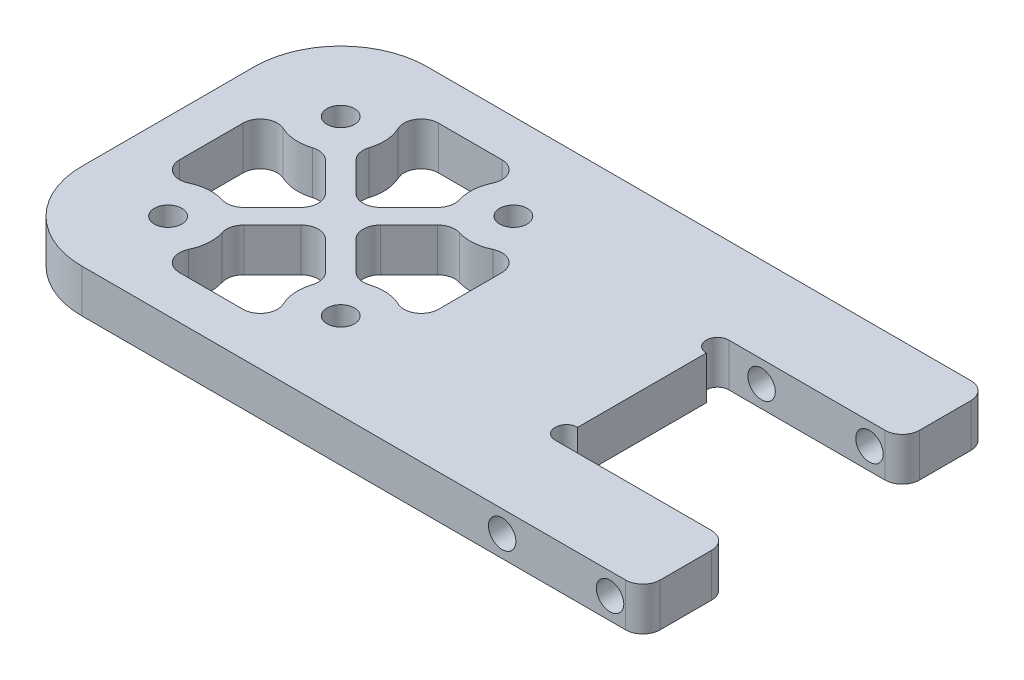
from build123d import *

# Parameters (mm, degrees)
BOSS_EXTRUDE1_DEPTH    = 6.35
F_10_32_TAPPED_HOLE2_D = 4.0386
SKETCH5_W              = 25.527
SKETCH5_H              = 25.526999999999994
CUT_EXTRUDE1_DEPTH     = 66.76160068763534
CUT_EXTRUDE2_DEPTH     = 66.76160068763534
FILLET1_R              = 2.54
FILLET2_R              = 12.7
F_10_32_TAPPED_HOLE1_D = 4.0386
CUT_EXTRUDE3_DEPTH     = 66.76160068763534
FILLET3_R              = 2.54


with BuildPart() as part:
    # Sketch1 → Boss-Extrude1 (new body)
    with BuildSketch(Plane(origin=(0, 0, 0), x_dir=(1, 0, 0), z_dir=(0, 1, 0))):
        Polygon((34.925, 25.4), (60.325, 25.4), (60.324999999999996, -25.399999999999995), (34.925, -25.400000000000002), (-34.925, -25.400000000000006), (-34.925, 25.39999999999999), align=None)
    extrude(amount=BOSS_EXTRUDE1_DEPTH)

    # #10-32 Tapped Hole2 (through all)
    with Locations(Plane(origin=(0, 6.35, 0), x_dir=(1, 0, 0), z_dir=(0, 1, 0))):
        with Locations((-22.225, 12.7), (3.175, 12.7), (3.175, -12.7), (-22.225, -12.7)):
            Hole(F_10_32_TAPPED_HOLE2_D / 2)

    # Sketch5 → Cut-Extrude1 (cut, through all)
    with BuildSketch(Plane(origin=(0, 6.35, 0), x_dir=(1, 0, 0), z_dir=(0, 1, 0))):
        with Locations((47.561499999999995, 1.78e-15)):
            Rectangle(SKETCH5_W, SKETCH5_H)
    extrude(amount=-CUT_EXTRUDE1_DEPTH, mode=Mode.SUBTRACT)

    # Sketch6 → Cut-Extrude2 (cut, through all)
    with BuildSketch(Plane(origin=(0, 6.35, 0), x_dir=(1, 0, 0), z_dir=(0, 1, 0))):
        with BuildLine():
            Line((34.797999999999995, 9.4615), (34.797999999999995, 12.763499999999999))
            ThreePointArc((34.797999999999995, 12.763499999999999), (33.14699999999999, 11.112499999999999), (34.797999999999995, 9.4615))
        make_face()
        with BuildLine():
            Line((34.79799999999999, -9.461499999999996), (34.79799999999999, -12.763499999999995))
            ThreePointArc((34.79799999999999, -12.763499999999995), (33.14699999999999, -11.112499999999995), (34.79799999999999, -9.461499999999996))
        make_face()
    extrude(amount=-CUT_EXTRUDE2_DEPTH, mode=Mode.SUBTRACT)

    # Fillet1
    fillet1_edges = [part.edges().sort_by_distance(p)[0] for p in [
        (60.324999999999996, 3.175, 12.763499999999995),
        (60.324999999999996, 3.175, -12.763499999999999),
        (60.325, 3.175, -25.4),
        (60.324999999999996, 3.175, 25.399999999999995),
    ]]
    fillet(fillet1_edges, radius=FILLET1_R)

    # Fillet2
    fillet2_edges = [part.edges().sort_by_distance(p)[0] for p in [
        (-34.925, 3.175, -25.39999999999999),
        (-34.925, 3.175, 25.400000000000006),
    ]]
    fillet(fillet2_edges, radius=FILLET2_R)

    # #10-32 Tapped Hole1 (through all)
    with Locations(Plane.XY.offset(25.400000000000013)):
        with Locations((55.499, 3.175), (39.624, 3.175)):
            Hole(F_10_32_TAPPED_HOLE1_D / 2)

    # Sketch11 → Cut-Extrude3 (cut, through all)
    with BuildSketch(Plane(origin=(0, 6.35, 0), x_dir=(1, 0, 0), z_dir=(0, 1, 0))):
        with BuildLine():
            Line((-22.224999999999994, 19.049999999999997), (3.175000000000006, 19.049999999999997))
            ThreePointArc((3.175000000000006, 19.049999999999997), (-2.338680723217193, 15.849892836656995), (-2.2950798153308978, 9.474984214936393))
            Line((-2.2950798153308978, 9.474984214936393), (-9.524999999999995, 2.2450640302672866))
            Line((-9.524999999999995, 2.2450640302672866), (-16.75492018466909, 9.474984214936393))
            ThreePointArc((-16.75492018466909, 9.474984214936393), (-16.711319276782792, 15.849892836656995), (-22.224999999999994, 19.049999999999997))
        make_face()
        with BuildLine():
            Line((9.525000000000006, -12.700000000000006), (9.525000000000006, 12.7))
            ThreePointArc((9.525000000000006, 12.7), (6.324892836656996, 7.186319276782797), (-0.0500157850636094, 7.229920184669101))
            Line((-0.0500157850636094, 7.229920184669101), (-7.2799359697327075, -5.45e-15))
            Line((-7.2799359697327075, -5.45e-15), (-0.05001578506361323, -7.229920184669112))
            ThreePointArc((-0.05001578506361323, -7.229920184669112), (6.324892836656994, -7.186319276782802), (9.525000000000006, -12.700000000000006))
        make_face()
        with BuildLine():
            Line((-28.574999999999996, 12.7), (-28.574999999999992, -12.700000000000006))
            ThreePointArc((-28.574999999999992, -12.700000000000006), (-25.374892836656983, -7.186319276782805), (-18.99998421493638, -7.22992018466911))
            Line((-18.99998421493638, -7.22992018466911), (-11.770064030267282, -4.31e-15))
            Line((-11.770064030267282, -4.31e-15), (-18.99998421493638, 7.229920184669105))
            ThreePointArc((-18.99998421493638, 7.229920184669105), (-25.37489283665699, 7.186319276782797), (-28.574999999999996, 12.7))
        make_face()
        with BuildLine():
            Line((-22.224999999999994, -19.050000000000004), (3.175000000000006, -19.050000000000004))
            ThreePointArc((3.175000000000006, -19.050000000000004), (-2.3386807232171964, -15.849892836657002), (-2.2950798153308987, -9.4749842149364))
            Line((-2.2950798153308987, -9.4749842149364), (-9.524999999999995, -2.245064030267295))
            Line((-9.524999999999995, -2.245064030267295), (-16.754920184669093, -9.4749842149364))
            ThreePointArc((-16.754920184669093, -9.4749842149364), (-16.711319276782795, -15.849892836657), (-22.224999999999994, -19.050000000000004))
        make_face()
    extrude(amount=-CUT_EXTRUDE3_DEPTH, mode=Mode.SUBTRACT)

    # Fillet3
    fillet3_edges = [part.edges().sort_by_distance(p)[0] for p in [
        (-22.224999999999994, 3.175, 19.050000000000004),
    ]]
    fillet(fillet3_edges, radius=FILLET3_R)
    fillet3_2_edges = [part.edges().sort_by_distance(p)[0] for p in [
        (-16.754920184669093, 3.175, 9.4749842149364),
    ]]
    fillet(fillet3_2_edges, radius=FILLET3_R)
    fillet3_3_edges = [part.edges().sort_by_distance(p)[0] for p in [
        (-9.524999999999995, 3.175, 2.245064030267295),
    ]]
    fillet(fillet3_3_edges, radius=FILLET3_R)
    fillet3_4_edges = [part.edges().sort_by_distance(p)[0] for p in [
        (-2.295079815330898, 3.175, 9.474984214936402),
    ]]
    fillet(fillet3_4_edges, radius=FILLET3_R)
    fillet3_5_edges = [part.edges().sort_by_distance(p)[0] for p in [
        (9.525000000000006, 3.175, 12.700000000000006),
    ]]
    fillet(fillet3_5_edges, radius=FILLET3_R)
    fillet3_6_edges = [part.edges().sort_by_distance(p)[0] for p in [
        (-0.05001578506361352, 3.175, 7.229920184669112),
    ]]
    fillet(fillet3_6_edges, radius=FILLET3_R)
    fillet3_7_edges = [part.edges().sort_by_distance(p)[0] for p in [
        (-7.2799359697327075, 3.175, 5.45e-15),
    ]]
    fillet(fillet3_7_edges, radius=FILLET3_R)
    fillet3_8_edges = [part.edges().sort_by_distance(p)[0] for p in [
        (-0.05001578506360961, 3.175, -7.229920184669101),
    ]]
    fillet(fillet3_8_edges, radius=FILLET3_R)
    fillet3_9_edges = [part.edges().sort_by_distance(p)[0] for p in [
        (9.525000000000006, 3.175, -12.7),
    ]]
    fillet(fillet3_9_edges, radius=FILLET3_R)
    fillet3_10_edges = [part.edges().sort_by_distance(p)[0] for p in [
        (-22.224999999999994, 3.175, -19.049999999999997),
    ]]
    fillet(fillet3_10_edges, radius=FILLET3_R)
    fillet3_11_edges = [part.edges().sort_by_distance(p)[0] for p in [
        (-16.75492018466909, 3.175, -9.474984214936391),
    ]]
    fillet(fillet3_11_edges, radius=FILLET3_R)
    fillet3_12_edges = [part.edges().sort_by_distance(p)[0] for p in [
        (-2.2950798153308973, 3.175, -9.474984214936395),
    ]]
    fillet(fillet3_12_edges, radius=FILLET3_R)
    fillet3_13_edges = [part.edges().sort_by_distance(p)[0] for p in [
        (-9.524999999999995, 3.175, -2.2450640302672866),
    ]]
    fillet(fillet3_13_edges, radius=FILLET3_R)
    fillet3_14_edges = [part.edges().sort_by_distance(p)[0] for p in [
        (-18.99998421493638, 3.175, -7.229920184669105),
    ]]
    fillet(fillet3_14_edges, radius=FILLET3_R)
    fillet3_15_edges = [part.edges().sort_by_distance(p)[0] for p in [
        (-11.770064030267282, 3.175, 4.31e-15),
    ]]
    fillet(fillet3_15_edges, radius=FILLET3_R)
    fillet3_16_edges = [part.edges().sort_by_distance(p)[0] for p in [
        (-18.99998421493638, 3.175, 7.229920184669109),
    ]]
    fillet(fillet3_16_edges, radius=FILLET3_R)
    fillet3_17_edges = [part.edges().sort_by_distance(p)[0] for p in [
        (3.175000000000006, 3.175, 19.050000000000004),
    ]]
    fillet(fillet3_17_edges, radius=FILLET3_R)
    fillet3_18_edges = [part.edges().sort_by_distance(p)[0] for p in [
        (3.175000000000006, 3.175, -19.049999999999997),
    ]]
    fillet(fillet3_18_edges, radius=FILLET3_R)
    fillet3_19_edges = [part.edges().sort_by_distance(p)[0] for p in [
        (-28.57499999999999, 3.175, 12.700000000000006),
    ]]
    fillet(fillet3_19_edges, radius=FILLET3_R)
    fillet3_20_edges = [part.edges().sort_by_distance(p)[0] for p in [
        (-28.574999999999996, 3.175, -12.7),
    ]]
    fillet(fillet3_20_edges, radius=FILLET3_R)


solid = part.part
